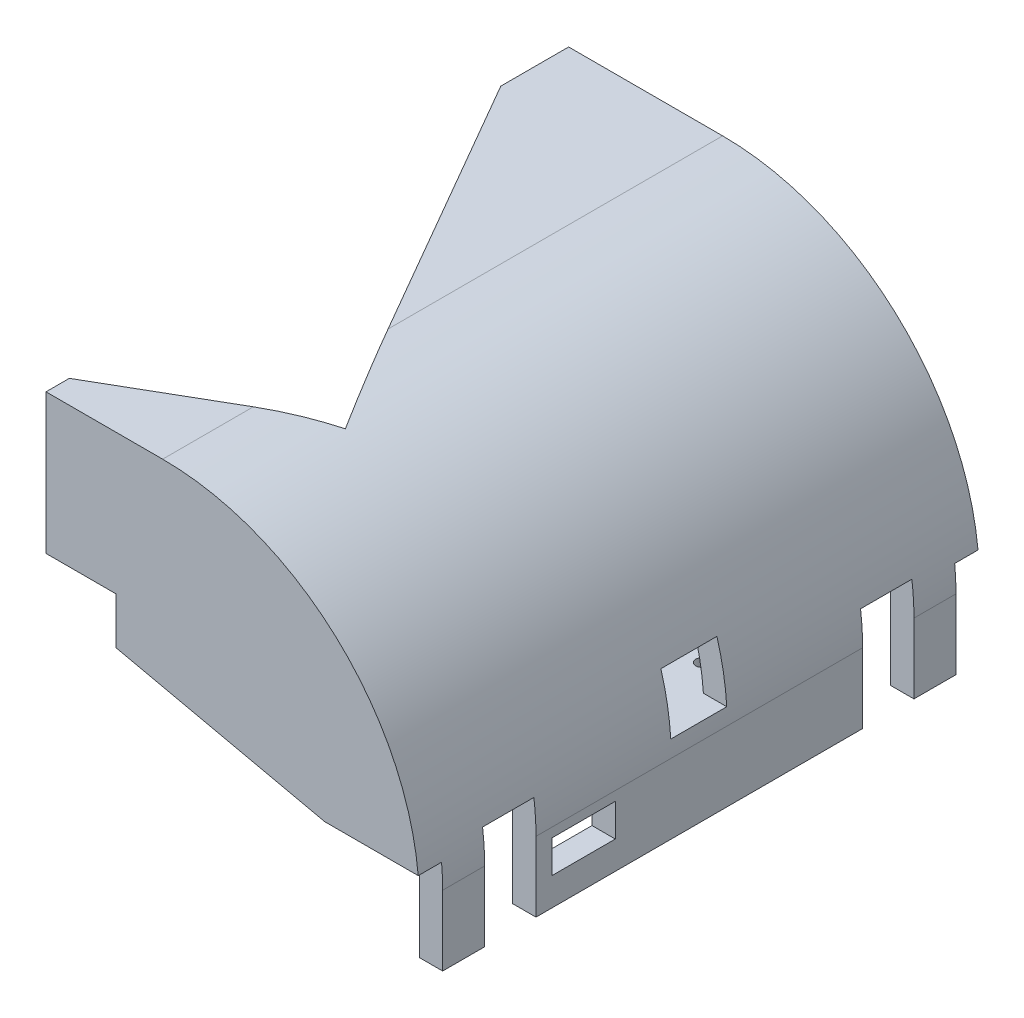
from build123d import *

# Parameters (mm, degrees)
BOSS_EXTRUDE1_DEPTH     = 110
SKETCH2_W               = 30
SKETCH2_H               = 12.5
BOSS_EXTRUDE2_DEPTH     = 35
SKETCH3_R               = 8
CUT_EXTRUDE1_DEPTH      = 121.603742452
SKETCH4_R               = 1.5
SKETCH4_R_2             = 1.25
CUT_EXTRUDE2_DEPTH      = 12.5
SKETCH5_W               = 9.5
SKETCH5_H               = 12.5
CUT_EXTRUDE3_DEPTH      = 121.603742452
FILLET4_R               = 0.5
BOSS_EXTRUDE3_DEPTH     = 5
CUT_EXTRUDE4_DEPTH      = 158.919156753
CUT_EXTRUDE4_DEPTH_BACK = 158.919156753
SKETCH7_W               = 12
SKETCH7_H               = 12
SKETCH7_W_2             = 11
SKETCH7_H_2             = 22
SKETCH7_W_3             = 13.6
SKETCH7_H_3             = 7
BOSS_EXTRUDE4_START     = 5
BOSS_EXTRUDE4_DEPTH     = 5
CUT_EXTRUDE5_START      = -30
CUT_EXTRUDE5_DEPTH      = 30


# Read off the part's stored shape, not the designer's step: Cut-Extrude5
with BuildPart() as part:
    # Sketch1 → Boss-Extrude1 (new body)
    with BuildSketch(Plane.XY):
        with BuildLine():
            Line((13.568, -0.541666667), (18.568, -0.541666667))
            Line((18.568, -0.541666667), (18.568, 14.458333333))
            ThreePointArc((18.568, 14.458333333), (2.458872965, 53.349206299), (-36.432, 69.458333333))
            Line((-36.432, 69.458333333), (-69.432, 69.458333333))
            Line((-69.432, 69.458333333), (-69.432, 64.458333333))
            Line((-69.432, 64.458333333), (-36.432, 64.458333333))
            ThreePointArc((-36.432, 64.458333333), (-1.076660941, 49.813672393), (13.568, 14.458333333))
            Line((13.568, 14.458333333), (13.568, -0.541666667))
        make_face()
    extrude(amount=BOSS_EXTRUDE1_DEPTH)

    # Sketch2 → Boss-Extrude2 (add)
    with BuildSketch(Plane.ZY.offset(-13.568)):
        with Locations((55, 11.708333333)):
            Rectangle(SKETCH2_W, SKETCH2_H)
    extrude(amount=BOSS_EXTRUDE2_DEPTH)

    # Sketch3 → Cut-Extrude1 (cut, through all)
    with BuildSketch(Plane(origin=(0, 0, 40), x_dir=(-1, 0, 0), z_dir=(0, 0, -1))):
        with Locations((3.932, 5.458333333)):
            Circle(SKETCH3_R)
    extrude(amount=-CUT_EXTRUDE1_DEPTH, mode=Mode.SUBTRACT)

    # Sketch4 → Cut-Extrude2 (cut)
    with BuildSketch(Plane.XZ.offset(-5.458333333)):
        with Locations(Location((-17.932, 43.5, 0), (0, 0, 270))):
            Circle(SKETCH4_R)
        with Locations(Location((-17.932, 66.5, 0), (0, 0, 270))):
            Circle(SKETCH4_R)
        with Locations(Location((7.568, 43.5, 0), (0, 0, 270))):
            Circle(SKETCH4_R_2)
        with Locations(Location((7.568, 66.5, 0), (0, 0, 270))):
            Circle(SKETCH4_R_2)
    extrude(amount=-CUT_EXTRUDE2_DEPTH, mode=Mode.SUBTRACT)

    # Sketch5 → Cut-Extrude3 (cut, through all)
    with BuildSketch(Plane(origin=(0, 0, 40), x_dir=(-1, 0, 0), z_dir=(0, 0, -1))):
        with Locations((16.682, 11.708333333)):
            Rectangle(SKETCH5_W, SKETCH5_H)
    extrude(amount=-CUT_EXTRUDE3_DEPTH, mode=Mode.SUBTRACT)

    # Fillet4
    fillet4_edges = [part.edges().sort_by_distance(p)[0] for p in [
        (-11.932, 5.458333333, 55),
    ]]
    fillet(fillet4_edges, radius=FILLET4_R)

    # Sketch6 → Boss-Extrude3 (add)
    with BuildSketch(Plane.XY.offset(110)):
        with BuildLine():
            Line((18.332493433, 19.542648335), (-1.667506567, 19.542648335))
            Line((-1.667506567, 19.542648335), (-46.432, 29.458333333))
            Line((-46.432, 29.458333333), (-46.432, 39.458333333))
            Line((-46.432, 39.458333333), (-69.432, 39.458333333))
            Line((-69.432, 39.458333333), (-69.432, 69.458333333))
            Line((-69.432, 69.458333333), (-36.432, 69.458333333))
            ThreePointArc((-36.432, 69.458333333), (0.617714404, 55.1070561), (18.332493433, 19.542648335))
        make_face()
    extrude(amount=BOSS_EXTRUDE3_DEPTH)

    # Sketch7 → Cut-Extrude4 (cut, two sides: drawn at the far end of the back side and taken through both)
    with BuildSketch(Plane.ZY.offset(-13.568).offset(-CUT_EXTRUDE4_DEPTH_BACK)):
        with Locations((55, 23.958333333)):
            Rectangle(SKETCH7_W, SKETCH7_H)
        with Locations((95.5, 10.458333333)):
            Rectangle(SKETCH7_W_2, SKETCH7_H_2)
        with Locations((14.5, 10.458333333)):
            Rectangle(SKETCH7_W_2, SKETCH7_H_2)
        with Locations((79.8, 8.958333333)):
            Rectangle(SKETCH7_W_3, SKETCH7_H_3)
    extrude(amount=CUT_EXTRUDE4_DEPTH + CUT_EXTRUDE4_DEPTH_BACK, mode=Mode.SUBTRACT)

    # Sketch8 → Boss-Extrude4 (add)
    with BuildSketch(Plane(origin=(0, 0, 0), x_dir=(-1, 0, 0), z_dir=(0, 0, -1)).offset(BOSS_EXTRUDE4_START)):
        with BuildLine():
            Line((36.432, 69.458333333), (69.432, 69.458333333))
            Line((69.432, 69.458333333), (69.432, 64.458333333))
            Line((69.432, 64.458333333), (69.432, 39.458333333))
            Line((69.432, 39.458333333), (46.432, 39.458333333))
            Line((46.432, 39.458333333), (46.432, 29.458333333))
            Line((46.432, 29.458333333), (1.707690959, 19.958333333))
            Line((1.707690959, 19.958333333), (-18.292309041, 19.958333333))
            ThreePointArc((-18.292309041, 19.958333333), (-0.463121629, 55.247425012), (36.432, 69.458333333))
        make_face()
    extrude(amount=-BOSS_EXTRUDE4_DEPTH)

    # Cut-Extrude5 outline → Cut-Extrude5 (cut)
    with BuildSketch(Plane(origin=(0, 69.458333333, 0), x_dir=(1, 0, 0), z_dir=(0, 1, 0)).offset(CUT_EXTRUDE5_START)):
        Polygon((-23.932, -88.349364905), (-69.432, -9.541053161), (-69.432, -115), (-61.432, -115), (-61.432, -110), align=None)
    extrude(amount=CUT_EXTRUDE5_DEPTH, mode=Mode.SUBTRACT)


solid = part.part
